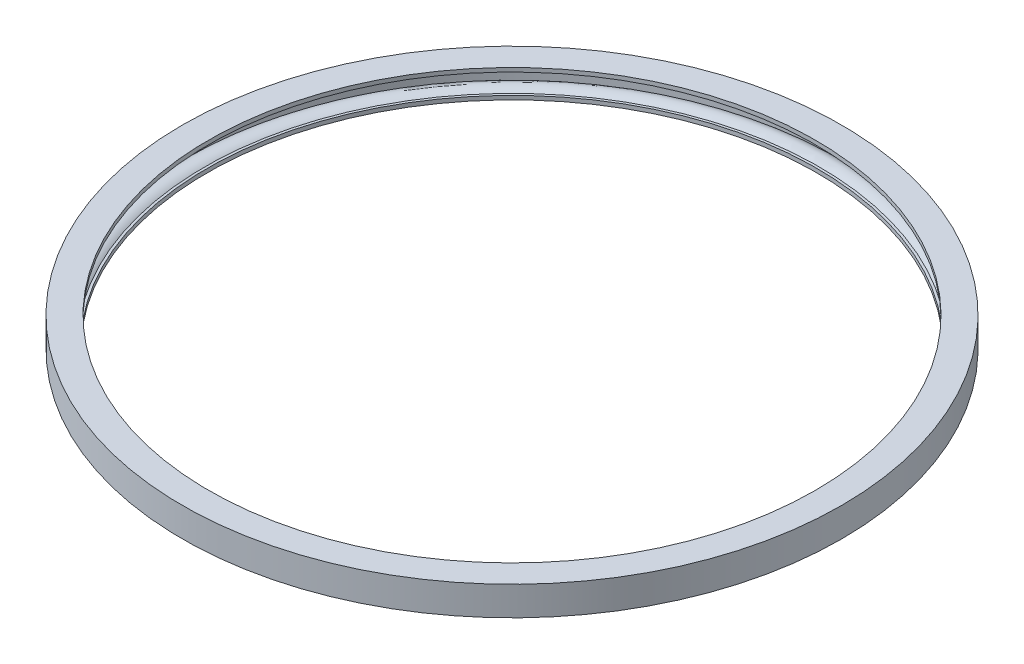
from build123d import *


with BuildPart() as part:
    # Sketch2 → Revolve1 (revolve)
    with BuildSketch(Plane(origin=(19.120852059, -95.867147226, 65.570618185), x_dir=(-0.9800835557204909, -4.980770021259261e-15, -0.1985855578995605), z_dir=(0.1985855578995605, 2.571409064264252e-15, -0.9800835557204909))):
        with BuildLine():
            ThreePointArc((-263.332584066, 5.221571347), (-258.227186422, 6.173270114), (-253.807584066, 8.900527101))
            Line((-253.807584066, 8.900527101), (-253.807584066, 7.161851411))
            Line((-253.807584066, 7.161851411), (-249.807584066, 7.161851411))
            Line((-249.807584066, 7.161851411), (-249.807584066, 11.221571347))
            Line((-249.807584066, 11.221571347), (-276.857584066, 11.221571347))
            Line((-276.857584066, 11.221571347), (-276.857584066, -18.820517146))
            Line((-276.857584066, -18.820517146), (-251.278247656, -18.820517146))
            Line((-251.278247656, -18.820517146), (-251.278247656, -14.76079721))
            Line((-251.278247656, -14.76079721), (-253.807584066, -14.76079721))
            Line((-253.807584066, -14.76079721), (-253.807584066, -16.499472899))
            ThreePointArc((-253.807584066, -16.499472899), (-258.227186422, -13.772215913), (-263.332584066, -12.820517146))
            ThreePointArc((-263.332584066, -12.820517146), (-268.437981711, -13.772215913), (-272.857584066, -16.499472899))
            Line((-272.857584066, -16.499472899), (-272.857584066, 8.900527101))
            ThreePointArc((-272.857584066, 8.900527101), (-268.437981711, 6.173270114), (-263.332584066, 5.221571347))
        make_face()
    revolve(axis=Axis((-43.303037422, -90.645575879, 52.922224232), (0, 1, 0)))


solid = part.part
